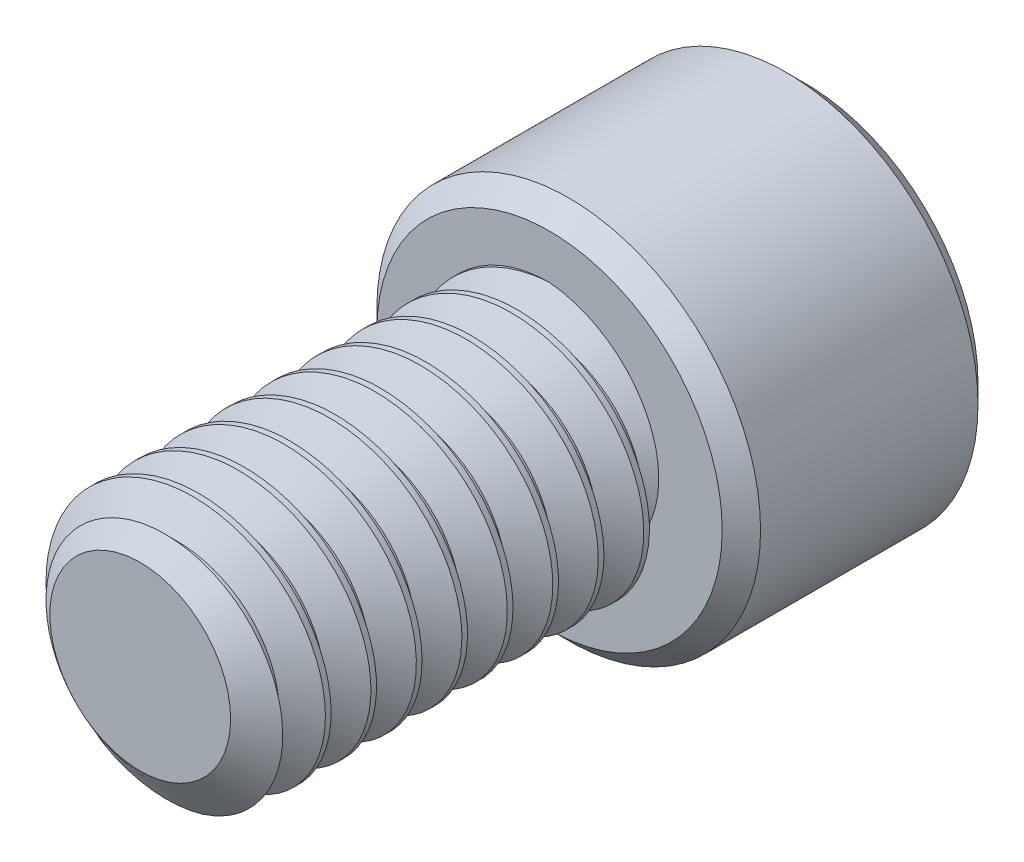
from build123d import *

# Parameters (mm, degrees)
SKETCH1_R          = 3.9751
EXTRUDE1_DEPTH     = 12.7
CUT_SWEEP1_PITCH   = 1.411111111
SKETCH6_R          = 5.953125
EXTRUDE2_DEPTH     = 7.9375
CUT_EXTRUDE1_DEPTH = 4.7625
CHAMFER1_SIZE      = 0.5953125


with BuildPart() as part:
    # Sketch1 → Extrude1 (new body)
    with BuildSketch(Plane.XY):
        Circle(SKETCH1_R)
    extrude(amount=-EXTRUDE1_DEPTH)

    # Cut-Sweep1: the profile of Sketch3 profile screwed along a right-hand helix of 10 turns, 6 arcs to a turn; built about Z, then put on its axis
    cut_sweep1_z = Axis((0, 0, 0), (0, 0, 1))
    cut_sweep1_corners = [(3.9754, 0, -1.234895427), (3.058556448, 0, -0.705555556), (3.058556448, 0, -0.529166667), (3.9754, 0, 0.000173205)]
    with BuildLine(mode=Mode.PRIVATE) as cut_sweep1_profile:
        Line(cut_sweep1_corners[0], cut_sweep1_corners[1])
        Line(cut_sweep1_corners[1], cut_sweep1_corners[2])
        Line(cut_sweep1_corners[2], cut_sweep1_corners[3])
        Line(cut_sweep1_corners[3], cut_sweep1_corners[0])
    cut_sweep1_cap = Face(cut_sweep1_profile.wire())
    cut_sweep1_turn_angles = [0, 30, 60, 90, 120, 150, 180, 210, 240, 270, 300, 330, 360]
    cut_sweep1_turn_weights = [1, 0.8660254037844387, 1, 0.8660254037844387, 1, 0.8660254037844387, 1, 0.8660254037844387, 1, 0.8660254037844387, 1, 0.8660254037844387, 1]
    cut_sweep1_turn_rails = [Edge.make_bspline([Vector(p[0], p[1], 0).rotate(cut_sweep1_z, cut_sweep1_turn_angles[k]) / cut_sweep1_turn_weights[k] + Vector(0, 0, p[2] + CUT_SWEEP1_PITCH * cut_sweep1_turn_angles[k] / 360) for k in range(13)], [0, 0, 0, 1, 1, 2, 2, 3, 3, 4, 4, 5, 5, 6, 6, 6], 2, cut_sweep1_turn_weights) for p in cut_sweep1_corners]
    cut_sweep1_turn_sides = [Face.make_surface_from_curves(cut_sweep1_turn_rails[p[0]], cut_sweep1_turn_rails[p[1]]) for p in [(0, 1), (1, 2), (2, 3), (3, 0)]]
    cut_sweep1 = Plane(origin=(0, 0, 0), x_dir=(0, 1, 0), z_dir=(0, 0, -1)) * Solid(Shell([*[p.moved(Location((0, 0, CUT_SWEEP1_PITCH * i))) for i in range(10) for p in cut_sweep1_turn_sides], cut_sweep1_cap, cut_sweep1_cap.rotate(cut_sweep1_z, 3600).moved(Location((0, 0, CUT_SWEEP1_PITCH * 3600 / 360)))]))
    add(cut_sweep1, mode=Mode.SUBTRACT)

    # Sketch4 → Cut-Revolve1 (revolve, cut)
    with BuildSketch(Plane(origin=(0, 0, 0), x_dir=(0, 0, -1), z_dir=(1, 0, 0)), mode=Mode.PRIVATE) as cut_revolve1_sk:
        Polygon((0.819623419, 3.9751), (0, 2.804556448), (0, 3.9751), align=None)
    revolve(cut_revolve1_sk.sketch.rotate(Axis((0, 0, 0), (0, 0, -1)), 224.846133378), axis=Axis((0, 0, 0), (0, 0, -1)), mode=Mode.SUBTRACT)

    # Sketch6 → Extrude2 (add)
    with BuildSketch(Plane(origin=(0, 0, -12.7), x_dir=(-1, 0, 0), z_dir=(0, 0, -1))):
        Circle(SKETCH6_R)
    extrude(amount=EXTRUDE2_DEPTH)

    # Sketch7 → Cut-Extrude1 (cut)
    with BuildSketch(Plane(origin=(0, 0, -20.6375), x_dir=(-1, 0, 0), z_dir=(0, 0, -1))):
        Polygon((0, 3.666174209), (-3.175, 1.833087105), (-3.175, -1.833087105), (0, -3.666174209), (3.175, -1.833087105), (3.175, 1.833087105), align=None)
    extrude(amount=-CUT_EXTRUDE1_DEPTH, mode=Mode.SUBTRACT)

    # Cut-Extrude2 cone 1 section (through the dimple's axis) → Cut-Extrude2 (revolve, cut)
    with BuildSketch(Plane(origin=(0, 0, -20.6375), x_dir=(0, 1, 0), z_dir=(1, 0, 0))):
        Polygon((0, 0), (3.666174209, 0), (0, 3.666174209), align=None)
    revolve(axis=Axis((0, 0, -20.6375), (0, 0, 1)), mode=Mode.SUBTRACT)

    # Chamfer1
    chamfer1_edges = [part.edges().sort_by_distance(p)[0] for p in [
        (5.953125, 0, -12.7),
        (5.953125, 0, -20.6375),
    ]]
    chamfer(chamfer1_edges, length=CHAMFER1_SIZE)


solid = part.part
